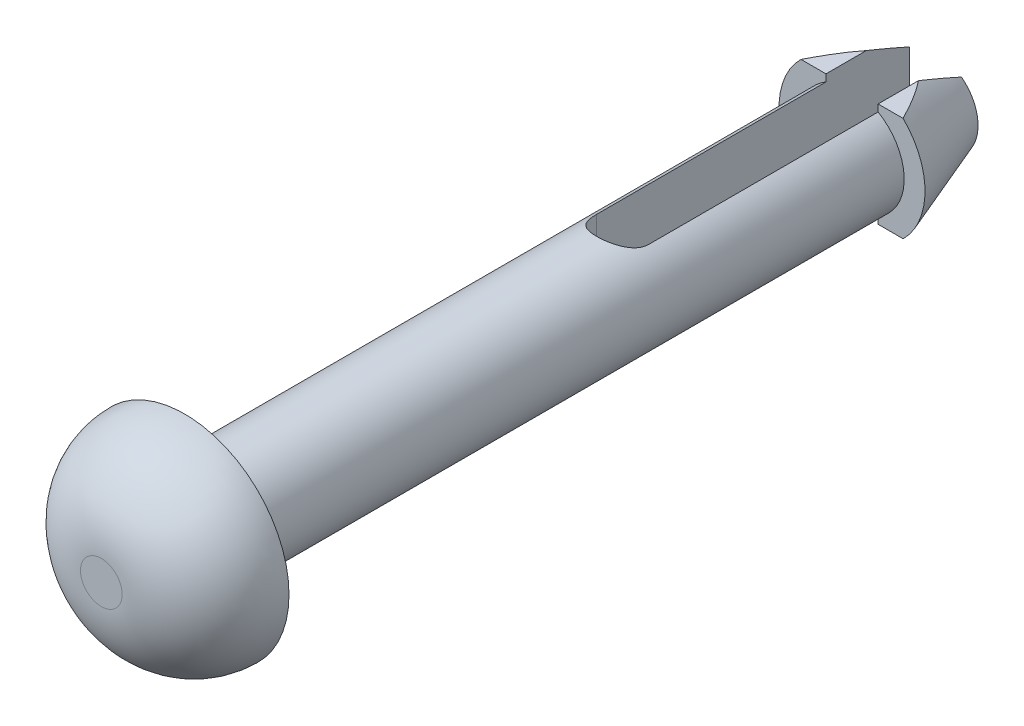
from build123d import *

# Parameters (mm, degrees)
SKETCH2_R           = 2.5
BOSS_EXTRUDE1_DEPTH = 32
BOSS_EXTRUDE2_DEPTH = 4
BOSS_EXTRUDE2_TAPER = 20
CUT_EXTRUDE1_DEPTH  = 6
CUT_EXTRUDE2_DEPTH  = 6
SKETCH6_R           = 5
BOSS_EXTRUDE3_DEPTH = 4
FILLET1_R           = 4


with BuildPart() as part:
    # Sketch2 → Boss-Extrude1 (new body)
    with BuildSketch(Plane.XY):
        Circle(SKETCH2_R)
    extrude(amount=BOSS_EXTRUDE1_DEPTH)

    # Sketch3 → Boss-Extrude2 (add)
    with BuildSketch(Plane(origin=(0, 0, 0), x_dir=(-1, 0, 0), z_dir=(0, 0, -1))):
        with BuildLine():
            ThreePointArc((2.910177967, 1.944444444), (0, 3.5), (-2.910177967, 1.944444444))
            ThreePointArc((-2.910177967, 1.944444444), (-3.5, 0), (-2.910177967, -1.944444444))
            ThreePointArc((-2.910177967, -1.944444444), (0, -3.5), (2.910177967, -1.944444444))
            ThreePointArc((2.910177967, -1.944444444), (3.349300142, -1.015966809), (3.5, 0))
            ThreePointArc((3.5, 0), (3.349300142, 1.015966809), (2.910177967, 1.944444444))
        make_face()
    extrude(amount=BOSS_EXTRUDE2_DEPTH, taper=BOSS_EXTRUDE2_TAPER)

    # Sketch4 → Cut-Extrude1 (cut)
    with BuildSketch(Plane.XY):
        Polygon((4.702019348, 2.5), (-6.119643092, 2.5), (-4.730091105, -2.5), (5.600315582, -2.5), (7.628500047, -1.168486898), (5.144149526, -5.126604677), (-5.530136189, -4.719564196), (-7.70569738, 3.519496572), (-2.540721352, 4.883331809), (4.16163802, 4.824833286), (4.784967696, 2.464223482), align=None)
    extrude(amount=-CUT_EXTRUDE1_DEPTH, mode=Mode.SUBTRACT)

    # Sketch5 → Cut-Extrude2 (cut)
    with BuildSketch(Plane(origin=(0, 2.5, 0), x_dir=(1, 0, 0), z_dir=(0, 1, 0))):
        with BuildLine():
            Line((1.25, 19), (1.25, -11))
            ThreePointArc((1.25, -11), (0, -12.25), (-1.25, -11))
            Line((-1.25, -11), (-1.25, 19))
            ThreePointArc((-1.25, 19), (0, 20.25), (1.25, 19))
        make_face()
    extrude(amount=-CUT_EXTRUDE2_DEPTH, mode=Mode.SUBTRACT)

    # Sketch6 → Boss-Extrude3 (add)
    with BuildSketch(Plane.XY.offset(32)):
        Circle(SKETCH6_R)
    extrude(amount=BOSS_EXTRUDE3_DEPTH)

    # Fillet1
    fillet1_edges = [part.edges().sort_by_distance(p)[0] for p in [
        (-5, 0, 36),
    ]]
    fillet(fillet1_edges, radius=FILLET1_R - 0.0001)  # a hair under: the kernel refuses the full size


solid = part.part
